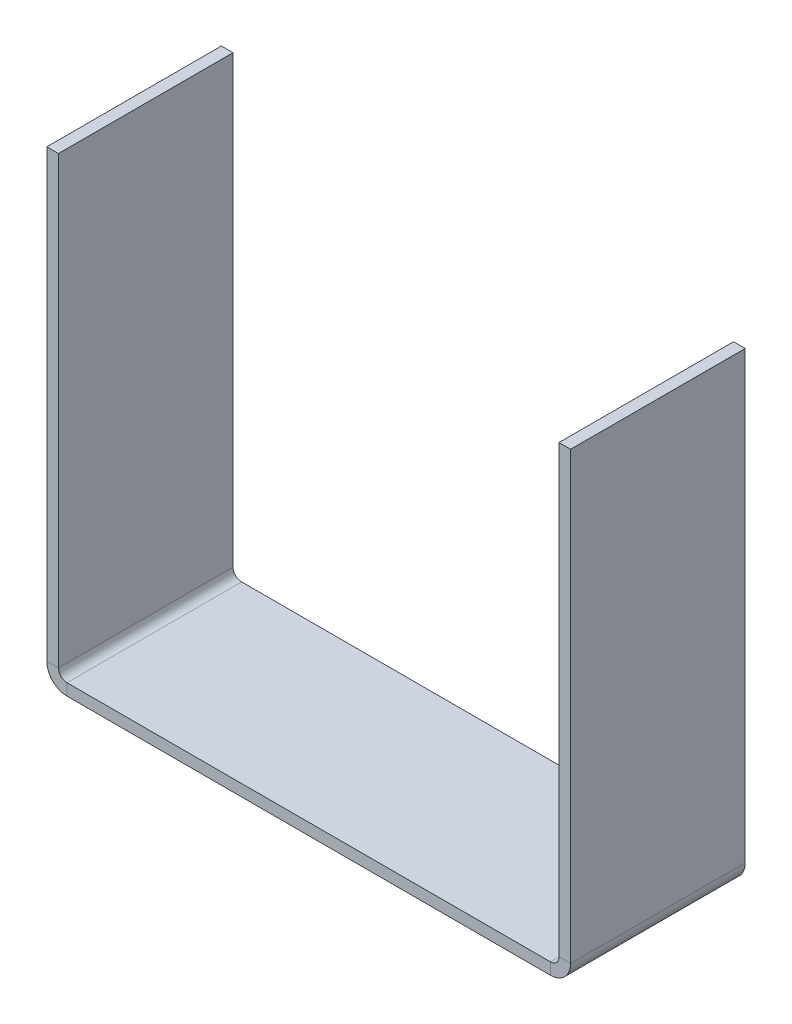
from build123d import *

# Parameters (mm, degrees)
SKETCH_1_W                       = 45
SKETCH_1_H                       = 15
SM_BASE_FLANGE_1_DEPTH           = 1
SM_EDGE_FLANGE_1_STRIP_W         = 5.4732
SM_EDGE_FLANGE_1_STRIP_H         = 1
SM_EDGE_FLANGE_1_STRIP_CUT_DEPTH = 15
SM_EDGE_FLANGE_1_DEPTH           = 15
SM_EDGE_FLANGE_2_STRIP_W         = 5.4732
SM_EDGE_FLANGE_2_STRIP_H         = 1
SM_EDGE_FLANGE_2_STRIP_CUT_DEPTH = 15
SM_EDGE_FLANGE_2_DEPTH           = 15


# Sheet-metal steps are written as plain solids
with BuildPart() as part:
    # Sketch 1 → Базовая кромка1 (new body)
    with BuildSketch(Plane(origin=(0, 0, 0), x_dir=(1, 0, 0), z_dir=(0, 1, 0))):
        with Locations((22.5, 7.5)):
            Rectangle(SKETCH_1_W, SKETCH_1_H)
    extrude(amount=-SM_BASE_FLANGE_1_DEPTH)

    # Ребро-кромка1 strip (across the edge) → Ребро-кромка1 strip cut (cut)
    with BuildSketch(Plane.XY.offset(-15)):
        with Locations((-1, -0.5)):
            Rectangle(SM_EDGE_FLANGE_1_STRIP_W, SM_EDGE_FLANGE_1_STRIP_H)
    extrude(amount=SM_EDGE_FLANGE_1_STRIP_CUT_DEPTH, mode=Mode.SUBTRACT)

    # Ребро-кромка1 section (across the edge) → Ребро-кромка1 (add)
    with BuildSketch(Plane.XY.offset(-15)):
        with BuildLine():
            Line((0, 0.7366), (0, 39))
            Line((0, 39), (1, 39))
            Line((1, 39), (1, 0.7366))
            ThreePointArc((1, 0.7366), (1.215745145, 0.215745145), (1.7366, 0))
            Line((1.7366, 0), (1.7366, -1))
            ThreePointArc((1.7366, -1), (0.508638364, -0.491361636), (0, 0.7366))
        make_face()
    extrude(amount=SM_EDGE_FLANGE_1_DEPTH)

    # Ребро-кромка2 strip (across the edge) → Ребро-кромка2 strip cut (cut)
    with BuildSketch(Plane(origin=(45, 0, 0), x_dir=(-1, 0, 0), z_dir=(0, 0, -1))):
        with Locations((-1, -0.5)):
            Rectangle(SM_EDGE_FLANGE_2_STRIP_W, SM_EDGE_FLANGE_2_STRIP_H)
    extrude(amount=SM_EDGE_FLANGE_2_STRIP_CUT_DEPTH, mode=Mode.SUBTRACT)

    # Ребро-кромка2 section (across the edge) → Ребро-кромка2 (add)
    with BuildSketch(Plane(origin=(45, 0, 0), x_dir=(-1, 0, 0), z_dir=(0, 0, -1))):
        with BuildLine():
            Line((0, 0.7366), (0, 39))
            Line((0, 39), (1, 39))
            Line((1, 39), (1, 0.7366))
            ThreePointArc((1, 0.7366), (1.215745145, 0.215745145), (1.7366, 0))
            Line((1.7366, 0), (1.7366, -1))
            ThreePointArc((1.7366, -1), (0.508638364, -0.491361636), (0, 0.7366))
        make_face()
    extrude(amount=SM_EDGE_FLANGE_2_DEPTH)


solid = part.part
